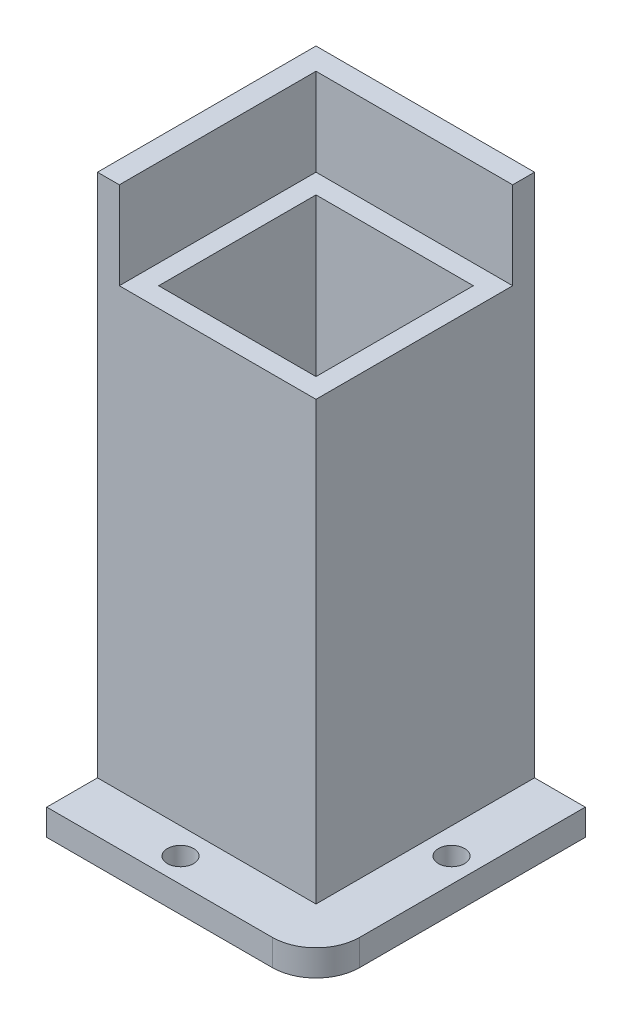
from build123d import *

# Parameters (mm, degrees)
SKETCH1_W           = 25
SKETCH1_H           = 25
BOSS_EXTRUDE1_DEPTH = 63
SKETCH2_W           = 22.5
SKETCH2_H           = 22.5
CUT_EXTRUDE2_DEPTH  = 10
SKETCH4_R           = 1.5
BOSS_EXTRUDE2_DEPTH = 3
SKETCH5_W           = 18
SKETCH5_H           = 18
CUT_EXTRUDE3_DEPTH  = 50


with BuildPart() as part:
    # Sketch1 → Boss-Extrude1 (new body)
    with BuildSketch(Plane(origin=(0, 0, 0), x_dir=(1, 0, 0), z_dir=(0, 1, 0))):
        Rectangle(SKETCH1_W, SKETCH1_H)
    extrude(amount=BOSS_EXTRUDE1_DEPTH)

    # Sketch2 → Cut-Extrude2 (cut)
    with BuildSketch(Plane(origin=(0, 63, 0), x_dir=(1, 0, 0), z_dir=(0, 1, 0))):
        with Locations((1.25, -1.25)):
            Rectangle(SKETCH2_W, SKETCH2_H)
    extrude(amount=-CUT_EXTRUDE2_DEPTH, mode=Mode.SUBTRACT)

    # Sketch4 → Boss-Extrude2 (add)
    with BuildSketch(Plane.XZ):
        with BuildLine():
            Line((12.5, 12.5), (12.5, -12.5))
            Line((12.5, -12.5), (18.3, -12.5))
            Line((18.3, -12.5), (18.3, 13.3))
            ThreePointArc((18.3, 13.3), (16.835533906, 16.835533906), (13.3, 18.3))
            Line((13.3, 18.3), (-12.5, 18.3))
            Line((-12.5, 18.3), (-12.5, 12.5))
            Line((-12.5, 12.5), (12.5, 12.5))
        make_face()
        with Locations((15.5, 0)):
            Circle(SKETCH4_R, mode=Mode.SUBTRACT)
        with Locations((0, 15.5)):
            Circle(SKETCH4_R, mode=Mode.SUBTRACT)
    extrude(amount=-BOSS_EXTRUDE2_DEPTH)

    # Sketch5 → Cut-Extrude3 (cut)
    with BuildSketch(Plane(origin=(0, 53, 0), x_dir=(1, 0, 0), z_dir=(0, 1, 0))):
        with Locations((1.25, -1.25)):
            Rectangle(SKETCH5_W, SKETCH5_H)
    extrude(amount=-CUT_EXTRUDE3_DEPTH, mode=Mode.SUBTRACT)


solid = part.part
